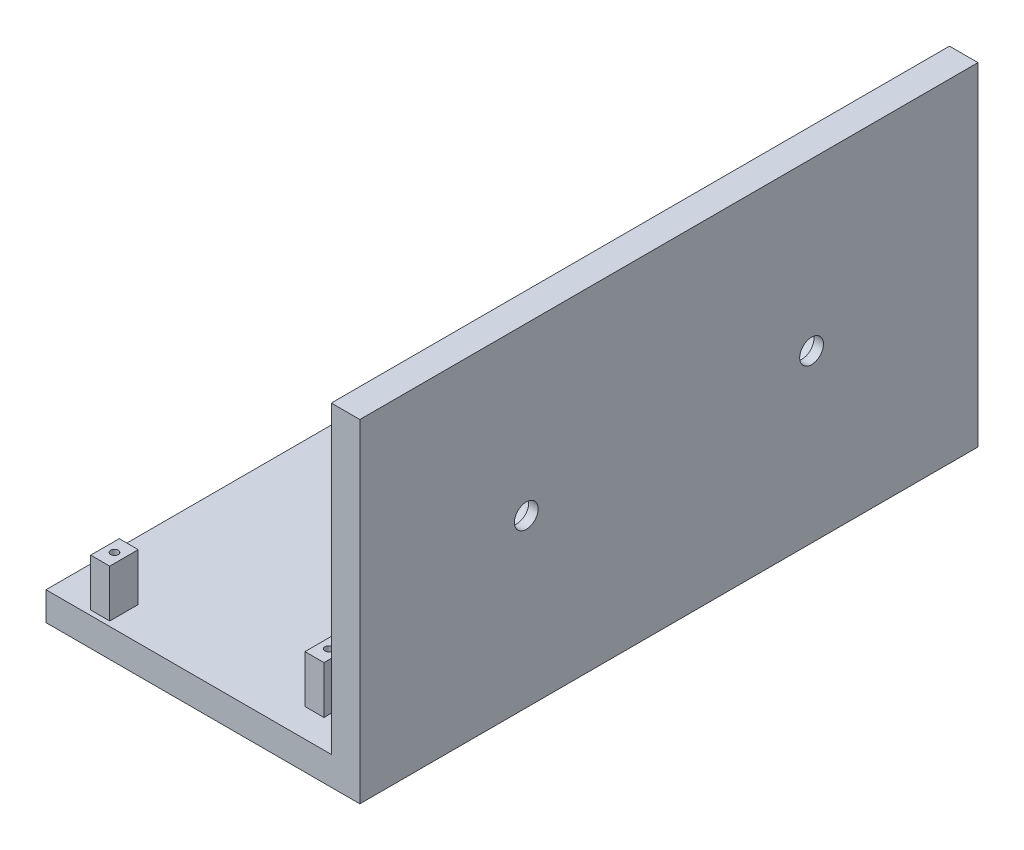
from build123d import *

# Parameters (mm, degrees)
BOSS_EXTRUDE1_DEPTH = 65
SKETCH2_R           = 0.4
SKETCH2_W           = 2
SKETCH2_H           = 3
BOSS_EXTRUDE2_DEPTH = 5
CUT_EXTRUDE2_REACH  = 81.612
CUT_EXTRUDE3_REACH  = 82.864
SKETCH4_R           = 1.25
SKETCH8_R           = 2.5
CUT_EXTRUDE6_DEPTH  = 2


with BuildPart() as part:
    # Sketch1 → Boss-Extrude1 (new body)
    with BuildSketch(Plane.XY):
        Polygon((0, 0), (33, 0), (33, 35), (30, 35), (30, 3), (0, 3), align=None)
    extrude(amount=BOSS_EXTRUDE1_DEPTH)

    # Sketch2 → Boss-Extrude2 (add)
    # profile 1 of 4: a face of its own
    with BuildSketch(Plane(origin=(0, 3, 0), x_dir=(1, 0, 0), z_dir=(0, 1, 0))):
        Polygon((24.25, -59.02), (24.25, -60.52), (24.25, -62.02), (26.25, -62.02), (26.25, -59.02), align=None)
        with Locations((25.25, -60.52)):
            Circle(SKETCH2_R, mode=Mode.SUBTRACT)
    # profile 2 of 4: a face of its own
    with BuildSketch(Plane(origin=(0, 3, 0), x_dir=(1, 0, 0), z_dir=(0, 1, 0))):
        Polygon((6.2, -64.5), (6.2, -63), (6.2, -61.5), (4.2, -61.5), (4.2, -64.5), align=None)
        with Locations((5.2, -63)):
            Circle(SKETCH2_R, mode=Mode.SUBTRACT)
    # profile 3 of 4: a face of its own
    with BuildSketch(Plane(origin=(0, 3, 0), x_dir=(1, 0, 0), z_dir=(0, 1, 0))):
        Polygon((7, -6.6), (7, -5.1), (7, -3.6), (5, -3.6), (5, -6.6), align=None)
        with Locations((6, -5.1)):
            Circle(SKETCH2_R, mode=Mode.SUBTRACT)
    # profile 4 of 4: a face of its own
    with BuildSketch(Plane(origin=(0, 3, 0), x_dir=(1, 0, 0), z_dir=(0, 1, 0))):
        with Locations((25.25, -4.48)):
            Rectangle(SKETCH2_W, SKETCH2_H)
        with Locations((25.25, -4.48)):
            Circle(SKETCH2_R, mode=Mode.SUBTRACT)
    extrude(amount=BOSS_EXTRUDE2_DEPTH)

    # Sketch3 → Cut-Extrude2 (cut, up to next)
    with BuildSketch(Plane(origin=(0, 3, 0), x_dir=(1, 0, 0), z_dir=(0, 1, 0)), mode=Mode.PRIVATE) as cut_extrude2_sk1:
        Polygon((15, -21.574281231), (30, -21.574281231), (30, -12.372736475), (13.5, -12.372736475), (13.5, -21.574281231), align=None)
    cut_extrude2_tool1 = extrude(cut_extrude2_sk1.sketch, amount=-CUT_EXTRUDE2_REACH, mode=Mode.PRIVATE) & part.part
    add(cut_extrude2_tool1.solids().sort_by_distance((21.75, 3, 16.973509))[0], mode=Mode.SUBTRACT)

    # Sketch4 → Cut-Extrude3 (cut, up to next)
    with BuildSketch(Plane(origin=(33, 0, 0), x_dir=(0, 0, -1), z_dir=(1, 0, 0)), mode=Mode.PRIVATE) as cut_extrude3_sk1:
        with Locations((-47.5, 17.5)):
            Circle(SKETCH4_R)
    cut_extrude3_tool1 = extrude(cut_extrude3_sk1.sketch, amount=-CUT_EXTRUDE3_REACH, mode=Mode.PRIVATE) & part.part
    # Sketch4 → Cut-Extrude3 (cut, up to next)
    with BuildSketch(Plane(origin=(33, 0, 0), x_dir=(0, 0, -1), z_dir=(1, 0, 0)), mode=Mode.PRIVATE) as cut_extrude3_sk2:
        with Locations((-17.5, 17.5)):
            Circle(SKETCH4_R)
    cut_extrude3_tool2 = extrude(cut_extrude3_sk2.sketch, amount=-CUT_EXTRUDE3_REACH, mode=Mode.PRIVATE) & part.part
    add(cut_extrude3_tool1.solids().sort_by_distance((33, 17.5, 47.5))[0], mode=Mode.SUBTRACT)
    add(cut_extrude3_tool2.solids().sort_by_distance((33, 17.5, 17.5))[0], mode=Mode.SUBTRACT)

    # Sketch8 → Cut-Extrude6 (cut)
    with BuildSketch(Plane.ZY.offset(-30)):
        with Locations((17.5, 17.5)):
            Circle(SKETCH8_R)
        with Locations((47.5, 17.5)):
            Circle(SKETCH8_R)
    extrude(amount=-CUT_EXTRUDE6_DEPTH, mode=Mode.SUBTRACT)


solid = part.part
